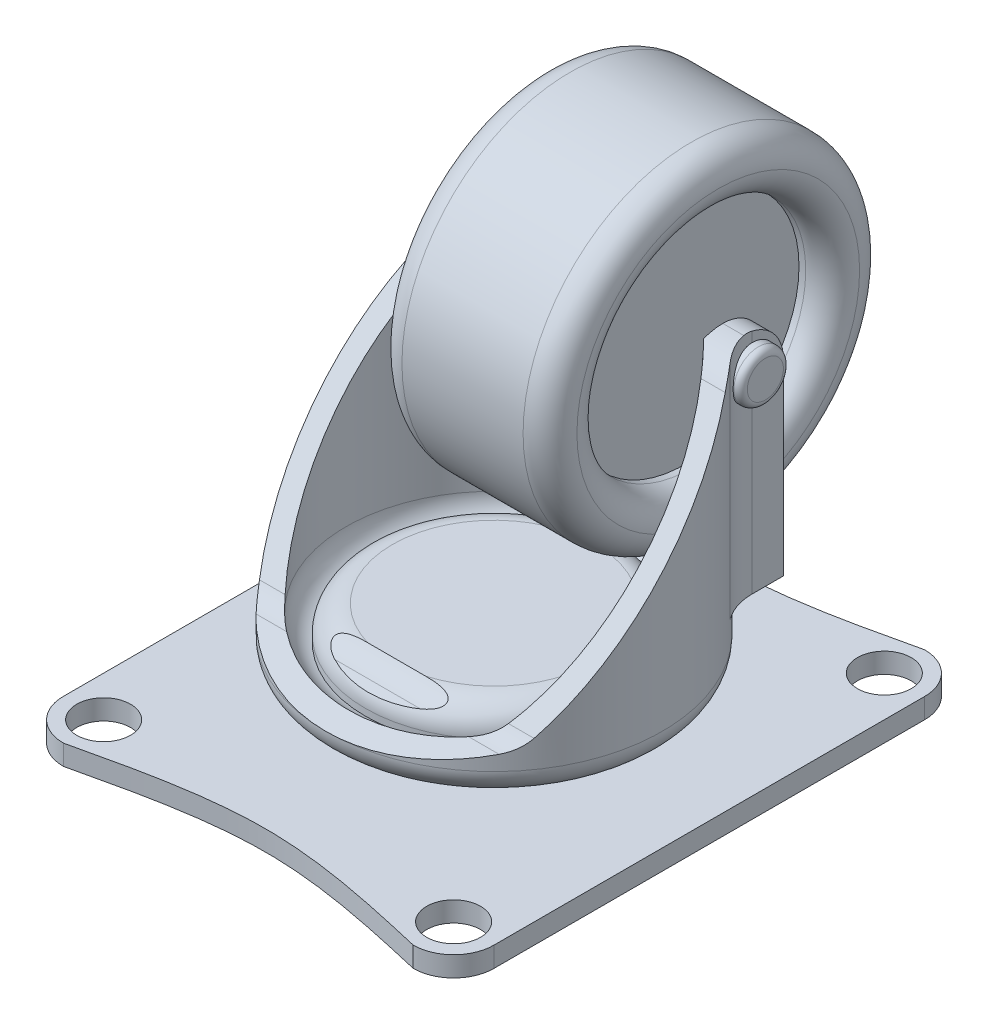
from build123d import *

# Parameters (mm, degrees)
SKETCH1_R               = 2
EXTRUDE1_DEPTH          = 1.5
SKETCH2_R               = 5
EXTRUDE2_DEPTH          = 2
FILLET1_R               = 1
FILLET2_R               = 1
SKETCH3_R               = 12.5
EXTRUDE3_DEPTH          = 4
SKETCH4_R               = 11
SKETCH4_R_2             = 9.55037161
CUT_EXTRUDE2_DEPTH      = 2.5
FILLET3_R               = 2
FILLET4_R               = 2
FILLET5_R               = 2
EXTRUDE4_DEPTH          = 17
FILLET6_R               = 4
SKETCH7_W               = 15
SKETCH7_H               = 1.5
CUT_EXTRUDE3_DEPTH      = 16
CUT_EXTRUDE4_DEPTH      = 16
CUT_EXTRUDE4_DEPTH_BACK = 63.791267279
SKETCH8_R               = 1.348970115
SKETCH9_R               = 1.169927738
EXTRUDE5_DEPTH          = 18
SKETCH10_R              = 1.841060147
EXTRUDE6_DEPTH          = 1
SKETCH11_R              = 1.654465514
EXTRUDE7_DEPTH          = 1
FILLET8_R               = 0.5
FILLET9_R               = 0.5
FILLET10_R              = 3
CUT_EXTRUDE5_DEPTH      = 60.780793317
CUT_EXTRUDE5_DEPTH_BACK = 60.780793317
FILLET11_R              = 4
EXTRUDE8_DEPTH          = 6.5
EXTRUDE8_DEPTH_BACK     = 6.5
SKETCH13_R              = 12.5
SKETCH15_R              = 8.5
CUT_EXTRUDE7_DEPTH      = 2.5
CUT_EXTRUDE9_START      = -3
SKETCH16_R              = 8.5
CUT_EXTRUDE9_DEPTH      = 3
FILLET12_R              = 2
FILLET13_R              = 2


# Some blends are built 0.0001 mm under size
with BuildPart() as part:
    # Sketch1 → Extrude1 (new body)
    with BuildSketch(Plane(origin=(0, 0, 0), x_dir=(1, 0, 0), z_dir=(0, 1, 0))):
        with BuildLine():
            Line((-25.056457243, 17.129581152), (-25.056457243, 49.129581152))
            ThreePointArc((-25.056457243, 49.129581152), (-24.177777586, 51.250901495), (-22.056457243, 52.129581152))
            add(Edge.make_bspline(
                [(-22.056457243, 52.129581152), (-17.723123909, 51.129581152), (-9.056457243, 49.129581152), (-0.389790576, 51.129581152), (3.943542757, 52.129581152)],
                knots=[0, 0, 0, 0, 0.5, 1, 1, 1, 1], degree=3))
            ThreePointArc((3.943542757, 52.129581152), (6.064863101, 51.250901495), (6.943542757, 49.129581152))
            Line((6.943542757, 49.129581152), (6.943542757, 17.129581152))
            ThreePointArc((6.943542757, 17.129581152), (6.064863101, 15.008260808), (3.943542757, 14.129581152))
            add(Edge.make_bspline(
                [(-22.056457243, 14.129581152), (-17.723123909, 15.129581152), (-9.056457243, 17.129581152), (-0.389790576, 15.129581152), (3.943542757, 14.129581152)],
                knots=[0, 0, 0, 0, 0.5, 1, 1, 1, 1], degree=3))
            ThreePointArc((-22.056457243, 14.129581152), (-24.177777586, 15.008260808), (-25.056457243, 17.129581152))
        make_face()
        with Locations(Location((-22.056457243, 17.129581152, 0), (0, 0, 270))):
            Circle(SKETCH1_R, mode=Mode.SUBTRACT)
        with Locations(Location((-22.056457243, 49.129581152, 0), (0, 0, 270))):
            Circle(SKETCH1_R, mode=Mode.SUBTRACT)
        with Locations(Location((3.943542757, 49.129581152, 0), (0, 0, 270))):
            Circle(SKETCH1_R, mode=Mode.SUBTRACT)
        with Locations(Location((3.943542757, 17.129581152, 0), (0, 0, 270))):
            Circle(SKETCH1_R, mode=Mode.SUBTRACT)
    extrude(amount=EXTRUDE1_DEPTH)

    # Sketch2 → Extrude2 (add)
    with BuildSketch(Plane(origin=(0, 1.5, 0), x_dir=(1, 0, 0), z_dir=(0, 1, 0))):
        with Locations(Location((-9.056457243, 33.129581152, 0), (0, 0, 270))):
            Circle(SKETCH2_R)
    extrude(amount=EXTRUDE2_DEPTH)

    # Fillet1
    fillet1_edges = [part.edges().sort_by_distance(p)[0] for p in [
        (-9.056457243, 1.5, -38.129581152),
    ]]
    fillet(fillet1_edges, radius=FILLET1_R)

    # Fillet2
    fillet2_edges = [part.edges().sort_by_distance(p)[0] for p in [
        (-9.056457243, 3.5, -38.129581152),
    ]]
    fillet(fillet2_edges, radius=FILLET2_R - 0.0001)  # a hair under: the kernel refuses the full size

    # Sketch3 → Extrude3 (add)
    with BuildSketch(Plane(origin=(0, 3.5, 0), x_dir=(1, 0, 0), z_dir=(0, 1, 0))):
        with Locations(Location((-9.056457243, 33.129581152, 0), (0, 0, 270))):
            Circle(SKETCH3_R)
    extrude(amount=EXTRUDE3_DEPTH)

    # Sketch4 → Cut-Extrude2 (cut)
    with BuildSketch(Plane(origin=(0, 7.5, 0), x_dir=(1, 0, 0), z_dir=(0, 1, 0))):
        with Locations(Location((-9.056457243, 33.129581152, 0), (0, 0, 270))):
            Circle(SKETCH4_R)
        with Locations(Location((-9.056457243, 33.129581152, 0), (0, 0, 270))):
            Circle(SKETCH4_R_2, mode=Mode.SUBTRACT)
    extrude(amount=-CUT_EXTRUDE2_DEPTH, mode=Mode.SUBTRACT)

    # Fillet3
    # the kernel refuses this fillet: 2 mm, written as the material it adds along each edge
    with BuildSketch(Plane(origin=(-9.056457243, 5, -33.129581152), x_dir=(0, 0, 1), z_dir=(-1, 0, 0))) as fillet3_piece_1:
        with BuildLine():
            CenterArc((9, 1.922782123), FILLET3_R, 285.973087222, 74.026912778)
            Line((9.55037161, 0), (9.561379042, -0.038455642))
            ThreePointArc((9.561379042, -0.038455642), (10.275185805, -0.04), (11, -0.04))
            Line((11, -0.04), (11.04, 0))
            Line((11.04, 0), (11.04, 1.922782123))
            Line((11.04, 1.922782123), (11, 1.922782123))
        make_face()
    revolve(axis=Axis((-9.056457243, 5, -33.129581152), (0, 1, 0)))

    # Fillet4
    fillet4_edges = [part.edges().sort_by_distance(p)[0] for p in [
        (-9.056457243, 3.5, -45.629581152),
    ]]
    fillet(fillet4_edges, radius=FILLET4_R)

    # Fillet5
    fillet5_edges = [part.edges().sort_by_distance(p)[0] for p in [
        (-9.056457243, 7.5, -42.679952762),
    ]]
    fillet(fillet5_edges, radius=FILLET5_R)

    # Sketch5 → Extrude4 (add)
    with BuildSketch(Plane(origin=(0, 7.5, 0), x_dir=(1, 0, 0), z_dir=(0, 1, 0))):
        with BuildLine():
            Line((-0.056457243, 45.629581152), (-18.056457243, 45.629581152))
            Line((-18.056457243, 45.629581152), (-18.056457243, 41.804256938))
            ThreePointArc((-18.056457243, 41.804256938), (-9.056457243, 20.629581152), (-0.056457243, 41.804256938))
            Line((-0.056457243, 41.804256938), (-0.056457243, 45.629581152))
        make_face()
        with BuildLine():
            Line((-1.556457243, 44.129581152), (-1.556457243, 41.176319622))
            ThreePointArc((-1.556457243, 41.176319622), (-9.056457243, 22.129581152), (-16.556457243, 41.176319622))
            Line((-16.556457243, 41.176319622), (-16.556457243, 44.129581152))
            Line((-16.556457243, 44.129581152), (-1.556457243, 44.129581152))
        make_face(mode=Mode.SUBTRACT)
    extrude(amount=EXTRUDE4_DEPTH)

    # Fillet6
    # the kernel refuses this fillet: 4 mm, written as the material it adds along each edge
    with BuildSketch(Plane(origin=(-18.056457243, 7.5, -41.804256938), x_dir=(-0.6557810458991542, 0, 0.7549511373853353), z_dir=(0, 1, 0))) as fillet6_piece_1:
        with BuildLine():
            CenterArc((1.500870497, -3.994639423), FILLET6_R, 92.966620009, 38.012279544)
            Line((-1.122253687, -0.974834873), (0, 0))
            ThreePointArc((0, 0), (0.646926938, -0.016751803), (1.293853877, 0))
        make_face()
    extrude(amount=17)
    with BuildSketch(Plane(origin=(-0.056457243, 7.5, -41.804256938), x_dir=(0.6557810458991536, 0, 0.7549511373853357), z_dir=(0, 1, 0))) as fillet6_piece_2:
        with BuildLine():
            CenterArc((1.500870497, 3.994639423), FILLET6_R, 229.021100447, 38.012279544)
            Line((-1.122253687, 0.974834873), (0, 0))
            ThreePointArc((0, 0), (0.646926938, 0.016751803), (1.293853877, 0))
        make_face()
    extrude(amount=17)

    # Sketch7 → Cut-Extrude3 (cut)
    with BuildSketch(Plane(origin=(0, 24.5, 0), x_dir=(1, 0, 0), z_dir=(0, 1, 0))):
        with Locations((-9.056457243, 44.879581152)):
            Rectangle(SKETCH7_W, SKETCH7_H)
    extrude(amount=-CUT_EXTRUDE3_DEPTH, mode=Mode.SUBTRACT)

    # Sketch8 → Cut-Extrude4 (cut, two sides: drawn at the far end of the back side and taken through both)
    with BuildSketch(Plane(origin=(-0.056457243, 0, 0), x_dir=(0, 0, -1), z_dir=(1, 0, 0)).offset(-CUT_EXTRUDE4_DEPTH_BACK)):
        with Locations(Location((43.290781868, 21.83610036, 0), (0, 0, 180))):
            Circle(SKETCH8_R)
    extrude(amount=CUT_EXTRUDE4_DEPTH + CUT_EXTRUDE4_DEPTH_BACK, mode=Mode.SUBTRACT)



with BuildPart() as body_2:
    # Sketch9 → Extrude5 (new body)
    with BuildSketch(Plane(origin=(-0.056457243, 0, 0), x_dir=(0, 0, -1), z_dir=(1, 0, 0))):
        with Locations((43.290781868, 21.83610036)):
            Circle(SKETCH9_R)
    extrude(amount=-EXTRUDE5_DEPTH)


with BuildPart() as part_1:
    add(part.part)

    add(body_2.part)  # Extrude6 merges body 2
    # Sketch10 → Extrude6 (add)
    with BuildSketch(Plane(origin=(-0.056457243, 0, 0), x_dir=(0, 0, -1), z_dir=(1, 0, 0))):
        with Locations(Location((43.290781868, 21.83610036, 0), (0, 0, 90))):
            Circle(SKETCH10_R)
    extrude(amount=EXTRUDE6_DEPTH)

    # Sketch11 → Extrude7 (add)
    with BuildSketch(Plane.ZY.offset(18.056457243)):
        with Locations(Location((-43.290781868, 21.83610036, 0), (0, 0, 270))):
            Circle(SKETCH11_R)
    extrude(amount=EXTRUDE7_DEPTH)

    # Fillet8
    fillet8_edges = [part_1.edges().sort_by_distance(p)[0] for p in [
        (-19.056457243, 23.490565874, -43.290781868),
    ]]
    fillet(fillet8_edges, radius=FILLET8_R)

    # Fillet9
    fillet9_edges = [part_1.edges().sort_by_distance(p)[0] for p in [
        (0.943542757, 19.995040213, -43.290781868),
    ]]
    fillet(fillet9_edges, radius=FILLET9_R)

    # Fillet10
    # the kernel refuses this fillet: 3 mm, written as the material it takes off along each edge
    with BuildSketch(Plane(origin=(7.443542757, 24.5, -45.629581152), x_dir=(0, -1, 0), z_dir=(-1, 0, 0)), Plane(origin=(-9.056457243, 24.5, -45.629581152), x_dir=(0, -1, 0), z_dir=(-1, 0, 0))) as fillet10_piece_1:
        with BuildLine():
            CenterArc((FILLET10_R, FILLET10_R), FILLET10_R, 180, 90)
            Line((0, FILLET10_R), (0, 0))
            Line((0, 0), (FILLET10_R, 0))
        make_face()
    extrude(amount=16.5, mode=Mode.SUBTRACT)

    # Sketch12 → Cut-Extrude5 (cut, two sides: drawn at the far end of the back side and taken through both)
    with BuildSketch(Plane.ZY.offset(9.056457243).offset(-CUT_EXTRUDE5_DEPTH_BACK)):
        with BuildLine():
            Line((-20.629581152, 24.5), (-40.827460482, 24.5))
            Line((-40.827460482, 24.5), (-25.905957926, 7.514188896))
            ThreePointArc((-25.905957926, 7.514188896), (-25.259398297, 6.961023264), (-24.483535335, 6.611640618))
            Line((-24.483535335, 6.611640618), (-20.629581152, 5.5))
            Line((-20.629581152, 5.5), (-20.629581152, 24.5))
        make_face()
    extrude(amount=CUT_EXTRUDE5_DEPTH + CUT_EXTRUDE5_DEPTH_BACK, mode=Mode.SUBTRACT)

    # Fillet11
    # the kernel refuses this fillet: 4 mm, written as the material it takes off along each edge
    with BuildSketch(Plane(origin=(-23.43069131, 24.5, -40.827460482), x_dir=(0, -5.750204404288881e-05, -0.9999999983467575), z_dir=(1, 0, 0)), Plane(origin=(-5.724557079, 24.5, -40.827460482), x_dir=(0, -5.75020440428872e-05, -0.9999999983467575), z_dir=(1, 0, 0))) as fillet11_piece_1:
        with BuildLine():
            CenterArc((1.810604963, -3.999861826), FILLET11_R, 90.476235999, 48.228766601)
            Line((-1.194682063, -1.360117541), (-1.495210766, -1.096143113))
            Line((-1.495210766, -1.096143113), (-0.300528703, 0.263974428))
            Line((-0.300528703, 0.263974428), (-2.3001e-05, 0.399999999))
            ThreePointArc((-2.3001e-05, 0.399999999), (1.802097666, 0.400103625), (1.774033085, 0.399986183))
            Line((1.774033085, 0.399986183), (1.777357801, 0))
        make_face()
    extrude(amount=11.042333904, mode=Mode.SUBTRACT)

    # Sketch13 → Extrude8 (add, two sides: drawn at the far end of the back side and taken through both)
    with BuildSketch(Plane.ZY.offset(9.056457243).offset(-EXTRUDE8_DEPTH_BACK)):
        with Locations((-43.290781868, 21.83610036)):
            Circle(SKETCH13_R)
    extrude(amount=EXTRUDE8_DEPTH + EXTRUDE8_DEPTH_BACK)

    # Sketch15 → Cut-Extrude7 (cut)
    with BuildSketch(Plane(origin=(-2.556457243, 0, 0), x_dir=(0, 0, -1), z_dir=(1, 0, 0))):
        with Locations((43.290781868, 21.83610036)):
            Circle(SKETCH15_R)
    extrude(amount=-CUT_EXTRUDE7_DEPTH, mode=Mode.SUBTRACT)

    # Sketch16 → Cut-Extrude9 (cut)
    with BuildSketch(Plane.ZY.offset(15.556457243).offset(CUT_EXTRUDE9_START)):
        with Locations((-43.290781868, 21.83610036)):
            Circle(SKETCH16_R)
    extrude(amount=CUT_EXTRUDE9_DEPTH, mode=Mode.SUBTRACT)


with BuildPart() as cut_extrude9_piece_1:
    # of the separate pieces the step leaves, piece 1, a body of its own (cut_extrude9_pieces)
    add(part_1.part.solids().sort_by_distance((-15.556457243, 21.83610036, -30.790781868))[0])

    # Fillet12
    fillet12_edges = [cut_extrude9_piece_1.edges().sort_by_distance(p)[0] for p in [
        (-2.556457243, 21.83610036, -34.790781868),
        (-2.556457243, 21.83610036, -55.790781868),
    ]]
    fillet(fillet12_edges, radius=FILLET12_R - 0.0001)  # a hair under: the kernel refuses the full size

    # Fillet13
    fillet13_edges = [cut_extrude9_piece_1.edges().sort_by_distance(p)[0] for p in [
        (-15.556457243, 21.83610036, -55.790781868),
        (-15.556457243, 21.83610036, -51.790781868),
    ]]
    fillet(fillet13_edges, radius=FILLET13_R - 0.0001)  # a hair under: the kernel refuses the full size


with BuildPart() as cut_extrude9_piece_2:
    # of the separate pieces the step leaves, piece 2, a body of its own (cut_extrude9_pieces)
    add(part_1.part.solids().sort_by_distance((0.443542757, 23.677160507, -43.290781868))[0])


solid = Compound([cut_extrude9_piece_1.part, cut_extrude9_piece_2.part])
